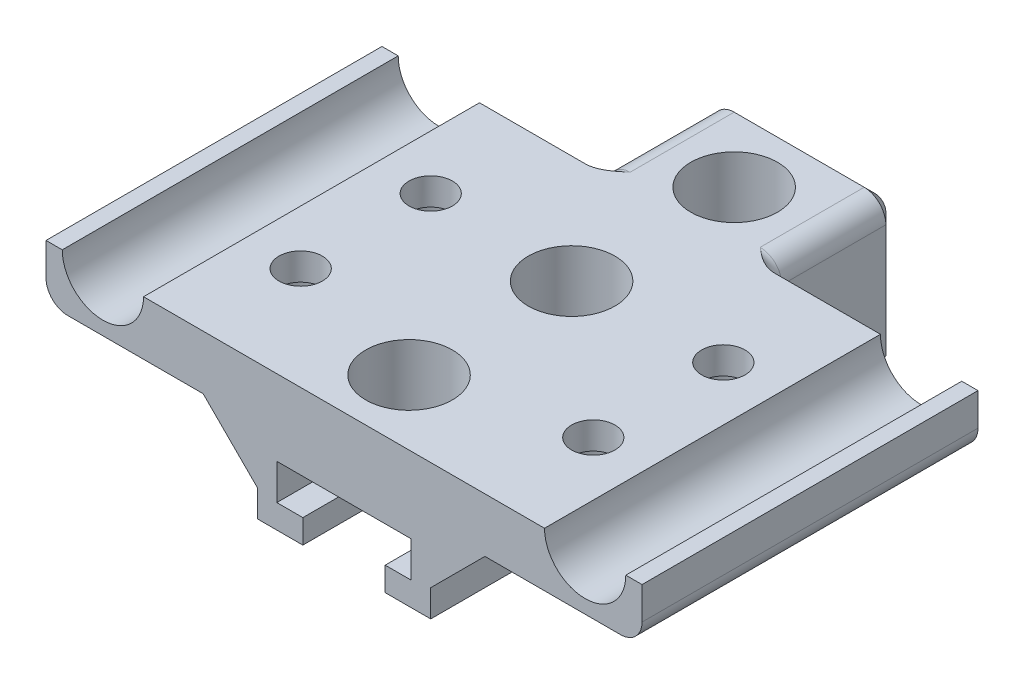
from build123d import *

# Parameters (mm, degrees)
SKETCH_1_W               = 16
SKETCH_1_H               = 8
EXTRUDE_1_DEPTH          = 43
CUT_EXTRUDE_1_DEPTH      = 44.920382512
EXTRUDE_2_DEPTH          = 31
FILLET_1_R               = 2
CHAMFER_1_SIZE           = 5
SKETCH_5_R               = 2
CUT_EXTRUDE_3_DEPTH      = 53.671149598
CUT_EXTRUDE_4_DEPTH      = 52.664784912
CUT_EXTRUDE_4_DEPTH_BACK = 2.5
SKETCH_6_R               = 3.75
SKETCH_8_W               = 16
SKETCH_8_H               = 5
EXTRUDE_4_DEPTH          = 12
SKETCH_3_R               = 4
CUT_EXTRUDE_2_DEPTH      = 6.2
SKETCH_10_W              = 4.2
SKETCH_10_H              = 0.5
CUT_EXTRUDE_5_DEPTH      = 52.829045911
FILLET_2_R               = 2
CHAMFER_2_SIZE           = 1
FILLET_3_R               = 1.4
CUT_EXTRUDE_6_DEPTH      = 1.2


with BuildPart() as part:
    # 草圖1 → 填料-伸長1 (new body)
    with BuildSketch(Plane.XY):
        Rectangle(SKETCH_1_W, SKETCH_1_H)
    extrude(amount=EXTRUDE_1_DEPTH)

    # 草圖2 → 除料-伸長1 (cut, through all)
    with BuildSketch(Plane.XY.offset(43)):
        Polygon((-6.2, 2), (6.2, 2), (6.2, -1.3), (3.8, -1.3), (3.8, -4), (-3.8, -4), (-3.8, -1.3), (-6.2, -1.3), align=None)
    extrude(amount=-CUT_EXTRUDE_1_DEPTH, mode=Mode.SUBTRACT)

    # 草圖4 → 填料-伸長2 (add)
    with BuildSketch(Plane.XY.offset(43)):
        with BuildLine():
            Line((-27.5, 4), (27.5, 4))
            Line((27.5, 4), (27.5, 9))
            Line((27.5, 9), (26, 9))
            ThreePointArc((26, 9), (22.25, 5.25), (18.5, 9))
            Line((18.5, 9), (-18.5, 9))
            ThreePointArc((-18.5, 9), (-22.25, 5.25), (-26, 9))
            Line((-26, 9), (-27.5, 9))
            Line((-27.5, 9), (-27.5, 4))
        make_face()
    extrude(amount=-EXTRUDE_2_DEPTH)

    # 圓角1
    fillet_1_edges = [part.edges().sort_by_distance(p)[0] for p in [
        (-27.5, 4, 27.5),
        (27.5, 4, 27.5),
    ]]
    fillet(fillet_1_edges, radius=FILLET_1_R)

    # 導角1
    chamfer_1_edges = [part.edges().sort_by_distance(p)[0] for p in [
        (-8, 4, 27.5),
        (8, 4, 27.5),
    ]]
    chamfer(chamfer_1_edges, length=CHAMFER_1_SIZE)

    # 草圖5 → 除料-伸長3 (cut, through all)
    with BuildSketch(Plane(origin=(0, 9, 0), x_dir=(1, 0, 0), z_dir=(0, 1, 0))):
        with Locations(Location((-13.5, -21.5, 0), (0, 0, 270))):
            Circle(SKETCH_5_R)
        with Locations(Location((13.5, -21.5, 0), (0, 0, 270))):
            Circle(SKETCH_5_R)
        with Locations(Location((13.5, -33.5, 0), (0, 0, 255.522487814))):
            Circle(SKETCH_5_R)
        with Locations(Location((-13.5, -33.5, 0), (0, 0, 284.477512186))):
            Circle(SKETCH_5_R)
    extrude(amount=-CUT_EXTRUDE_3_DEPTH, mode=Mode.SUBTRACT)

    # 草圖6 → 除料-伸長4 (cut, two sides: drawn at the far end of the back side and taken through both)
    with BuildSketch(Plane.XZ.offset(-4).offset(-CUT_EXTRUDE_4_DEPTH_BACK)):
        with Locations(Location((-13.5, 21.5, 0), (0, 0, 82.337744339))):
            Circle(SKETCH_6_R)
        with Locations(Location((13.5, 21.5, 0), (0, 0, 97.662255661))):
            Circle(SKETCH_6_R)
        with Locations(Location((13.5, 33.5, 0), (0, 0, 97.662255661))):
            Circle(SKETCH_6_R)
        with Locations(Location((-13.5, 33.5, 0), (0, 0, 82.337744339))):
            Circle(SKETCH_6_R)
    extrude(amount=CUT_EXTRUDE_4_DEPTH + CUT_EXTRUDE_4_DEPTH_BACK, mode=Mode.SUBTRACT)

    # 草圖8 → 填料-伸長4 (add)
    with BuildSketch(Plane(origin=(0, 0, 12), x_dir=(-1, 0, 0), z_dir=(0, 0, -1))):
        with Locations((0, 6.5)):
            Rectangle(SKETCH_8_W, SKETCH_8_H)
    extrude(amount=EXTRUDE_4_DEPTH)

    # 草圖3 → 除料-伸長2 (cut)
    with BuildSketch(Plane(origin=(0, 9, 0), x_dir=(1, 0, 0), z_dir=(0, 1, 0))):
        with Locations(Location((0, -37, 0), (0, 0, 270))):
            Circle(SKETCH_3_R)
        with Locations(Location((0, -22, 0), (0, 0, 270))):
            Circle(SKETCH_3_R)
        with Locations(Location((0, -7, 0), (0, 0, 270))):
            Circle(SKETCH_3_R)
    extrude(amount=-CUT_EXTRUDE_2_DEPTH, mode=Mode.SUBTRACT)

    # 草圖10 → 除料-伸長5 (cut, through all)
    with BuildSketch(Plane.XY.offset(43)):
        with Locations((-5.9, -3.75)):
            Rectangle(SKETCH_10_W, SKETCH_10_H)
        with Locations((5.9, -3.75)):
            Rectangle(SKETCH_10_W, SKETCH_10_H)
    extrude(amount=-CUT_EXTRUDE_5_DEPTH, mode=Mode.SUBTRACT)

    # 圓角2
    fillet_2_edges = [part.edges().sort_by_distance(p)[0] for p in [
        (-8, 9, 6),
        (8, 9, 6),
    ]]
    fillet(fillet_2_edges, radius=FILLET_2_R)

    # 導角2
    chamfer_2_edges = [part.edges().sort_by_distance(p)[0] for p in [
        (8, 1.75, 0),
        (0, 9, 0),
        (-8, 1.75, 0),
        (-7.414213562, 8.414213562, 0),
        (7.414213562, 8.414213562, 0),
    ]]
    chamfer(chamfer_2_edges, length=CHAMFER_2_SIZE)

    # 圓角3
    # the kernel refuses this fillet: 1.4 mm, written as the material it adds along each edge
    with BuildSketch(Plane(origin=(8, -4.5, 12), x_dir=(1, 0, 0), z_dir=(0, 1, 0))) as fillet_3_piece_1_section:
        with BuildLine():
            CenterArc((FILLET_3_R, FILLET_3_R), FILLET_3_R, 180, 90)
            Line((0, FILLET_3_R), (0, 0))
            Line((0, 0), (FILLET_3_R, 0))
        make_face()
    fillet_3_piece_1 = extrude(amount=11.5, mode=Mode.PRIVATE)
    fillet_3_piece_1 = split(fillet_3_piece_1, bisect_by=Plane(origin=(10.227813123, 1.227813123, 11.682011334), z_dir=(-0.7071067811865476, 0.7071067811865476, 0)), keep=Keep.TOP, mode=Mode.PRIVATE)
    add(fillet_3_piece_1)
    with BuildSketch(Plane(origin=(6, 7, 12), x_dir=(-0.9838603986795805, -0.17893774311211444, 0), z_dir=(0.17893774311211444, -0.9838603986795805, 0))) as fillet_3_piece_2_section:
        with BuildLine():
            CenterArc((2 + FILLET_3_R, FILLET_3_R), FILLET_3_R, 180, 90)
            Line((2 + FILLET_3_R, 0), (2, 0))
            Line((2, 0), (2, FILLET_3_R))
        make_face()
    fillet_3_piece_2 = revolve(axis=Axis((6, 7, 12), (0, 0, -1)), revolution_arc=190.307892466, mode=Mode.PRIVATE)
    fillet_3_piece_2 = split(fillet_3_piece_2, bisect_by=Plane(origin=(7.48329526, 9, 11.594565302), z_dir=(0, -1, 0)), keep=Keep.TOP, mode=Mode.PRIVATE)
    add(fillet_3_piece_2)
    with BuildSketch(Plane(origin=(-6, 7, 12), x_dir=(-1, 0, 0), z_dir=(0, -1, 0))) as fillet_3_piece_3_section:
        with BuildLine():
            CenterArc((2 + FILLET_3_R, FILLET_3_R), FILLET_3_R, 180, 90)
            Line((2 + FILLET_3_R, 0), (2, 0))
            Line((2, 0), (2, FILLET_3_R))
        make_face()
    fillet_3_piece_3 = revolve(axis=Axis((-6, 7, 12), (0, 0, -1)), revolution_arc=190.307892466, mode=Mode.PRIVATE)
    fillet_3_piece_3 = split(fillet_3_piece_3, bisect_by=Plane(origin=(-7.483295503, 9, 11.594566119), z_dir=(0, -1, 0)), keep=Keep.TOP, mode=Mode.PRIVATE)
    add(fillet_3_piece_3)
    with BuildSketch(Plane(origin=(-8, 7, 12), x_dir=(-1, 0, 0), z_dir=(0, -1, 0))) as fillet_3_piece_4_section:
        with BuildLine():
            CenterArc((FILLET_3_R, FILLET_3_R), FILLET_3_R, 180, 90)
            Line((0, FILLET_3_R), (0, 0))
            Line((0, 0), (FILLET_3_R, 0))
        make_face()
    fillet_3_piece_4 = extrude(amount=11.5, mode=Mode.PRIVATE)
    fillet_3_piece_4 = split(fillet_3_piece_4, bisect_by=Plane(origin=(-10.227813123, 1.227813123, 11.682011334), z_dir=(0.7071067811865476, 0.7071067811865476, 0)), keep=Keep.TOP, mode=Mode.PRIVATE)
    add(fillet_3_piece_4)

    # 草圖11 → 除料-伸長6 (cut)
    with BuildSketch(Plane(origin=(0, 0, 12), x_dir=(-1, 0, 0), z_dir=(0, 0, -1))):
        with BuildLine():
            add(Edge.make_bspline(
                [(-15.512965599, 5.255270581), (-15.414699377, 5.254159841), (-15.26654504, 5.269723993), (-15.070634174, 5.312629682), (-14.922188504, 5.360307872), (-14.772442736, 5.419941039), (-14.566974287, 5.518690642), (-14.419631195, 5.612638429), (-14.32170289, 5.67916026)],
                knots=[0, 0, 0, 0, 0.2291586, 0.346856629, 0.467982157, 0.59294755, 0.723185428, 1, 1, 1, 1], degree=3))
            add(Edge.make_bspline(
                [(-14.32170289, 5.67916026), (-14.361340614, 5.594402497), (-14.427448519, 5.473531235), (-14.525046047, 5.32243655), (-14.59983006, 5.21930979), (-14.679966937, 5.12588537), (-14.788204646, 5.012348241), (-14.878028191, 4.938643616), (-14.939972919, 4.894613063)],
                knots=[0, 0, 0, 0, 0.27789803, 0.408711059, 0.534275942, 0.656039227, 0.774144342, 1, 1, 1, 1], degree=3))
            add(Edge.make_bspline(
                [(-14.939972919, 4.894613063), (-14.989961256, 4.860663807), (-15.066962934, 4.814288531), (-15.174875072, 4.765966289), (-15.255511766, 4.735728118), (-15.337665232, 4.71338948), (-15.448713915, 4.691252394), (-15.533528007, 4.684203399), (-15.590249352, 4.684619833)],
                knots=[0, 0, 0, 0, 0.261398337, 0.387279958, 0.510791555, 0.633341278, 0.754911106, 1, 1, 1, 1], degree=3))
            add(Edge.make_bspline(
                [(-15.590249352, 4.684619833), (-15.666958981, 4.685092807), (-15.781638901, 4.69593118), (-15.928175213, 4.737366431), (-16.033718561, 4.779870577), (-16.135531308, 4.8345345), (-16.267361332, 4.92714585), (-16.357743573, 5.010420269), (-16.413048104, 5.07259989)],
                knots=[0, 0, 0, 0, 0.245474022, 0.365588279, 0.485788951, 0.608632713, 0.734185237, 1, 1, 1, 1], degree=3))
            add(Edge.make_bspline(
                [(-16.413048104, 5.07259989), (-16.486436291, 5.149790085), (-16.580821506, 5.281541796), (-16.680597485, 5.47550639), (-16.739967268, 5.635472042), (-16.788300278, 5.806560812), (-16.83307316, 6.058448797), (-16.845414663, 6.255134367), (-16.845524868, 6.389546279)],
                knots=[0, 0, 0, 0, 0.224560157, 0.340653479, 0.46005785, 0.584555283, 0.715942709, 1, 1, 1, 1], degree=3))
            add(Edge.make_bspline(
                [(-16.845524868, 6.389546279), (-16.845766789, 6.522968639), (-16.837283777, 6.718272995), (-16.803554657, 6.970044363), (-16.768245124, 7.143122359), (-16.724254813, 7.30589546), (-16.652769819, 7.505080593), (-16.581732618, 7.64380008), (-16.527802769, 7.729911988)],
                knots=[0, 0, 0, 0, 0.286836376, 0.419499479, 0.545655081, 0.666291914, 0.781656117, 1, 1, 1, 1], degree=3))
            add(Edge.make_bspline(
                [(-16.527802769, 7.729911988), (-16.475253534, 7.808774507), (-16.389068606, 7.920852663), (-16.247606636, 8.039056504), (-16.136046853, 8.111398184), (-16.015003992, 8.165978133), (-15.840022534, 8.220849525), (-15.70011978, 8.234017061), (-15.605862232, 8.234207997)],
                knots=[0, 0, 0, 0, 0.259167332, 0.381556643, 0.501241574, 0.620640046, 0.742518077, 1, 1, 1, 1], degree=3))
            add(Edge.make_bspline(
                [(-15.605862232, 8.234207997), (-15.544717191, 8.233967403), (-15.422688438, 8.220230604), (-15.307161955, 8.178413821), (-15.253011154, 8.150679092)],
                knots=[0, 0, 0, 0, 0.501438966, 1, 1, 1, 1], degree=3))
            add(Edge.make_bspline(
                [(-15.253011154, 8.150679092), (-15.232275736, 8.133755314), (-15.206788091, 8.107140401), (-15.173989427, 8.076950865), (-15.158151075, 8.059412734), (-15.147479909, 8.046273137), (-15.141652243, 8.039053711), (-15.140693744, 8.035516612)],
                knots=[0, 0, 0, 0, 0.465485033, 0.641943688, 0.776824332, 0.876730976, 0.937633266, 0.937633266, 0.937633266, 0.937633266], degree=3))
            add(Edge.make_bspline(
                [(-15.140693744, 8.035516612), (-15.133787772, 8.044366191), (-15.116403306, 8.070385906), (-15.077167958, 8.152583209), (-15.048667508, 8.22671454), (-15.028185689, 8.282607924)],
                knots=[0.030175483, 0.030175483, 0.030175483, 0.030175483, 0.149660543, 0.364790765, 1, 1, 1, 1], degree=3))
            add(Edge.make_bspline(
                [(-15.028185689, 8.282607924), (-15.009725876, 8.276858426), (-14.981099314, 8.261367171), (-14.943150161, 8.231982222), (-14.907607028, 8.201886929), (-14.868383119, 8.164770132), (-14.80765487, 8.102314078), (-14.760586835, 8.051494923), (-14.729199046, 8.014066396)],
                knots=[0, 0, 0, 0, 0.142547286, 0.238878223, 0.355067871, 0.487276599, 0.63850083, 1, 1, 1, 1], degree=3))
            add(Edge.make_bspline(
                [(-14.729199046, 8.014066396), (-14.679820714, 7.954832181), (-14.596630502, 7.84611307), (-14.554817703, 7.714879841), (-14.554334795, 7.656531454)],
                knots=[0, 0, 0, 0, 0.573162062, 1, 1, 1, 1], degree=3))
            add(Edge.make_bspline(
                [(-14.554334795, 7.656531454), (-14.55573328, 7.604762947), (-14.559344601, 7.529719841), (-14.59079845, 7.441578691), (-14.620378906, 7.389562676), (-14.660674885, 7.349448476), (-14.728595988, 7.309280902), (-14.78991609, 7.301591113), (-14.830682763, 7.301338445)],
                knots=[0, 0, 0, 0, 0.30492955, 0.43093638, 0.544107034, 0.651620768, 0.75931712, 1, 1, 1, 1], degree=3))
            add(Edge.make_bspline(
                [(-14.830682763, 7.301338445), (-14.841544953, 7.302291561), (-14.86032407, 7.310786374), (-14.889744485, 7.326072081), (-14.922917623, 7.344860193), (-14.963714625, 7.368183839), (-15.032329193, 7.410250355), (-15.087326472, 7.444594797), (-15.12654683, 7.4691769)],
                knots=[0, 0, 0, 0, 0.094521052, 0.179484873, 0.292195612, 0.429600385, 0.592893667, 1, 1, 1, 1], degree=3))
            add(Edge.make_bspline(
                [(-15.12654683, 7.4691769), (-15.199975384, 7.514202137), (-15.343776237, 7.586470467), (-15.502111383, 7.616327936), (-15.575417117, 7.616718611)],
                knots=[0, 0, 0, 0, 0.541453495, 1, 1, 1, 1], degree=3))
            add(Edge.make_bspline(
                [(-15.575417117, 7.616718611), (-15.615784116, 7.616596914), (-15.677009176, 7.607829628), (-15.752469197, 7.574778739), (-15.8067654, 7.540709431), (-15.858552546, 7.497438846), (-15.926261978, 7.423131816), (-15.96951886, 7.357849076), (-15.996184221, 7.310706172)],
                knots=[0, 0, 0, 0, 0.221792064, 0.333701628, 0.449768155, 0.572417113, 0.702735877, 1, 1, 1, 1], degree=3))
            add(Edge.make_bspline(
                [(-15.996184221, 7.310706172), (-16.027670327, 7.257543102), (-16.064164483, 7.168850026), (-16.10264178, 7.042622477), (-16.126743645, 6.935639477), (-16.145175717, 6.819587789), (-16.162879041, 6.647083036), (-16.168974735, 6.513023329), (-16.167925896, 6.420772038)],
                knots=[0, 0, 0, 0, 0.201775088, 0.313152638, 0.432066248, 0.560725755, 0.697893267, 1, 1, 1, 1], degree=3))
            add(Edge.make_bspline(
                [(-16.167925896, 6.420772038), (-16.166824182, 6.32573813), (-16.162572512, 6.187254805), (-16.137709457, 6.010213972), (-16.113107174, 5.89141668), (-16.081314281, 5.782406175), (-16.030568676, 5.653793585), (-15.980529466, 5.566139031), (-15.940758498, 5.514444381)],
                knots=[0, 0, 0, 0, 0.300345914, 0.43641313, 0.564039626, 0.683111862, 0.794491467, 1, 1, 1, 1], degree=3))
            add(Edge.make_bspline(
                [(-15.940758498, 5.514444381), (-15.910669985, 5.474312305), (-15.863169015, 5.418543093), (-15.791748561, 5.356567409), (-15.738783043, 5.319582648), (-15.684200812, 5.29100235), (-15.610149731, 5.263799104), (-15.55180694, 5.25480104), (-15.512965599, 5.255270581)],
                knots=[0, 0, 0, 0, 0.290049453, 0.421162096, 0.545441934, 0.662452142, 0.776130833, 1, 1, 1, 1], degree=3))
        make_face()
        with BuildLine():
            add(Edge.make_bspline(
                [(-12.044282778, 6.7745997), (-12.043995062, 6.799091234), (-12.043783764, 6.823584331)],
                knots=[0.941138595, 0.941138595, 0.941138595, 1, 1, 1], degree=2))
            add(Edge.make_bspline(
                [(-12.043783764, 6.823584331), (-12.042862242, 6.934444436), (-12.039522555, 7.09029638), (-12.037800584, 7.283907298), (-12.035878046, 7.397353644), (-12.035284005, 7.489474465), (-12.034568268, 7.570142602), (-12.033344474, 7.620096948), (-12.033635392, 7.646383083)],
                knots=[0, 0, 0, 0, 0.404182111, 0.568316414, 0.705889519, 0.817838935, 0.904174919, 1, 1, 1, 1], degree=3))
            add(Edge.make_bspline(
                [(-12.033635392, 7.646383083), (-12.034899202, 7.67602141), (-12.033504068, 7.717231246), (-12.037267638, 7.767958818), (-12.040017024, 7.796360332), (-12.043969284, 7.818911498), (-12.048621353, 7.837090967), (-12.05435247, 7.848269832), (-12.060957932, 7.849350517)],
                knots=[0, 0, 0, 0, 0.424717304, 0.588998461, 0.72762706, 0.833577365, 0.914932906, 1, 1, 1, 1], degree=3))
            add(Edge.make_bspline(
                [(-12.060957932, 7.849350517), (-12.05984125, 7.843986649), (-12.0754378, 7.840419153), (-12.09289379, 7.828422377), (-12.123679656, 7.814354662), (-12.162359505, 7.795573714), (-12.233224644, 7.761133243), (-12.291252391, 7.734200438), (-12.33340268, 7.715079753)],
                knots=[0, 0, 0, 0, 0.046726134, 0.118814664, 0.227505899, 0.369395017, 0.545604088, 1, 1, 1, 1], degree=3))
            add(Edge.make_bspline(
                [(-12.33340268, 7.715079753), (-12.303824675, 7.791756497), (-12.261595729, 7.900730259), (-12.189948661, 8.028059832), (-12.140892818, 8.102097962), (-12.090529052, 8.159842917), (-12.025774629, 8.213091691), (-11.969728398, 8.235350961), (-11.932151675, 8.234207997)],
                knots=[0, 0, 0, 0, 0.35894422, 0.507247956, 0.636247595, 0.745524815, 0.839950671, 1, 1, 1, 1], degree=3))
            add(Edge.make_bspline(
                [(-11.932151675, 8.234207997), (-11.901026373, 8.233467713), (-11.853341724, 8.22904328), (-11.793049576, 8.207283032), (-11.747774966, 8.186267084), (-11.702619207, 8.159619918), (-11.642907315, 8.112712021), (-11.601145982, 8.071546734), (-11.574616734, 8.041388935)],
                knots=[0, 0, 0, 0, 0.223861911, 0.338171268, 0.457371705, 0.581031901, 0.712581509, 1, 1, 1, 1], degree=3))
            add(Edge.make_bspline(
                [(-11.574616734, 8.041388935), (-11.543902053, 8.010016731), (-11.504496538, 7.96055959), (-11.456600155, 7.894922755), (-11.4300151, 7.847488138), (-11.409187098, 7.801698088), (-11.387587337, 7.744682639), (-11.382590112, 7.700460093), (-11.381797671, 7.672144334)],
                knots=[0, 0, 0, 0, 0.308571641, 0.445382466, 0.571801884, 0.690743521, 0.799749167, 1, 1, 1, 1], degree=3))
            add(Edge.make_bspline(
                [(-11.381797671, 7.672144334), (-11.381684503, 7.668484799), (-11.38276822, 7.659903255), (-11.384460567, 7.644594107), (-11.385546322, 7.623679097), (-11.389535701, 7.59703292), (-11.391540271, 7.548416195), (-11.397674703, 7.509367086), (-11.398971839, 7.480886559)],
                knots=[0, 0, 0, 0, 0.057089948, 0.134745619, 0.240739599, 0.383929581, 0.555081239, 1, 1, 1, 1], degree=3))
            add(Edge.make_bspline(
                [(-11.398971839, 7.480886559), (-11.41376156, 7.324650293), (-11.420049226, 7.167848325)],
                knots=[0, 0, 0, 1, 1, 1], degree=2))
            add(Edge.make_bspline(
                [(-11.420049226, 7.167848325), (-11.42935424, 6.909796791), (-11.439483364, 6.377916998), (-11.444590196, 5.845974218), (-11.44424919, 5.572212035)],
                knots=[0, 0, 0, 0, 0.485384535, 1, 1, 1, 1], degree=3))
            add(Edge.make_bspline(
                [(-11.44424919, 5.572212035), (-11.445242149, 5.458578271), (-11.454689637, 5.249352056), (-11.507303846, 5.046442061), (-11.542610331, 4.958625869)],
                knots=[0, 0, 0, 0, 0.546327903, 1, 1, 1, 1], degree=3))
            add(Edge.make_bspline(
                [(-11.542610331, 4.958625869), (-11.557596685, 4.911069002), (-11.579683855, 4.843188441), (-11.623224357, 4.764561061), (-11.656537903, 4.718626307), (-11.693535301, 4.682455404), (-11.747071133, 4.648939215), (-11.792319258, 4.636441738), (-11.822861519, 4.637781195)],
                knots=[0, 0, 0, 0, 0.328144135, 0.464957548, 0.588231467, 0.699328578, 0.802125792, 1, 1, 1, 1], degree=3))
            add(Edge.make_bspline(
                [(-11.822861519, 4.637781195), (-11.847029004, 4.637443438), (-11.88433909, 4.647659512), (-11.930192852, 4.67544365), (-11.966926809, 4.704778343), (-12.004625299, 4.741669621), (-12.041895775, 4.787639311), (-12.080166667, 4.841656541), (-12.118515395, 4.904107402), (-12.15917636, 4.973838681), (-12.197948905, 5.053037778), (-12.239997855, 5.139415411), (-12.280726078, 5.234849659), (-12.323159876, 5.338058907), (-12.381852844, 5.491714723), (-12.424956695, 5.611570297), (-12.452060564, 5.69477314)],
                knots=[0, 0, 0, 0, 0.056453286, 0.089167736, 0.125855281, 0.167058501, 0.213234192, 0.265139963, 0.323001969, 0.385916018, 0.455312491, 0.530755317, 0.612338233, 0.69981122, 0.793781828, 1, 1, 1, 1], degree=3))
            add(Edge.make_bspline(
                [(-12.452060564, 5.69477314), (-12.414457953, 5.681531143), (-12.359682514, 5.66595505), (-12.291336404, 5.64407296), (-12.247524651, 5.63365219), (-12.210010371, 5.62383544), (-12.170720789, 5.616330959), (-12.144106134, 5.612498746), (-12.128093314, 5.612024878)],
                knots=[0, 0, 0, 0, 0.356585115, 0.509864577, 0.642065772, 0.75957823, 0.856883807, 1, 1, 1, 1], degree=3))
            add(Edge.make_bspline(
                [(-12.128093314, 5.612024878), (-12.117288114, 5.611827175), (-12.09336706, 5.622929662), (-12.082666245, 5.647034231), (-12.077351455, 5.659644161)],
                knots=[0, 0, 0, 0, 0.428655626, 1, 1, 1, 1], degree=3))
            add(Edge.make_bspline(
                [(-12.077351455, 5.659644161), (-12.067435561, 5.700100127), (-12.053909703, 5.810680507), (-12.055279923, 5.921971959), (-12.053932136, 5.991417851)],
                knots=[0, 0, 0, 0, 0.374325657, 1, 1, 1, 1], degree=3))
            add(Edge.make_bspline(
                [(-12.053932136, 5.991417851), (-12.054238316, 6.019005049), (-12.053004838, 6.071041225), (-12.052288205, 6.154311457), (-12.051694918, 6.247993556), (-12.049774622, 6.362220524), (-12.048960282, 6.452937159), (-12.048270723, 6.50565666), (-12.048165992, 6.513360279)],
                knots=[0, 0, 0, 0, 0.099436359, 0.18761446, 0.300179787, 0.437142363, 0.599429252, 0.627201587, 0.627201587, 0.627201587, 0.627201587], degree=3))
            add(Edge.make_bspline(
                [(-12.048165992, 6.513360279), (-12.048526695, 6.513202708), (-12.064626961, 6.506177692), (-12.120191756, 6.483062416), (-12.177837902, 6.466449008), (-12.218648015, 6.454339729)],
                knots=[0.450888695, 0.450888695, 0.450888695, 0.450888695, 0.454476239, 0.610994776, 1, 1, 1, 1], degree=3))
            add(Edge.make_bspline(
                [(-12.218648015, 6.454339729), (-12.299882111, 6.433676973), (-12.414110762, 6.407165144), (-12.554956008, 6.372514996), (-12.636446229, 6.354556404), (-12.700616321, 6.3381403), (-12.75381902, 6.32715726), (-12.785278017, 6.320701726), (-12.801008422, 6.318507677)],
                knots=[0, 0, 0, 0, 0.420417791, 0.588208002, 0.727522358, 0.838959474, 0.920368149, 1, 1, 1, 1], degree=3))
            add(Edge.make_bspline(
                [(-12.801008422, 6.318507677), (-12.826340217, 6.318045067), (-12.864957219, 6.325630581), (-12.913395046, 6.348603443), (-12.950005092, 6.373294181), (-12.987029742, 6.404003622), (-13.038085923, 6.456798783), (-13.072550227, 6.502964307), (-13.094530557, 6.536307347)],
                knots=[0, 0, 0, 0, 0.199082476, 0.305665486, 0.421303183, 0.546739767, 0.684715424, 1, 1, 1, 1], degree=3))
            add(Edge.make_bspline(
                [(-13.094530557, 6.536307347), (-13.098879231, 6.458922542), (-13.10948971, 6.331989271), (-13.121395744, 6.186349983), (-13.127485958, 6.117995896), (-13.129203147, 6.099323718)],
                knots=[0, 0, 0, 0, 0.419764578, 0.689913437, 0.7914802, 0.7914802, 0.7914802, 0.7914802], degree=3))
            add(Edge.make_bspline(
                [(-13.129203147, 6.099323718), (-13.124058547, 6.106156513), (-13.105158008, 6.129896973), (-13.046081155, 6.194345835), (-12.98706381, 6.246899923), (-12.94386627, 6.284159342)],
                knots=[0.343318873, 0.343318873, 0.343318873, 0.343318873, 0.407545732, 0.570919874, 1, 1, 1, 1], degree=3))
            add(Edge.make_bspline(
                [(-12.94386627, 6.284159342), (-12.977519555, 6.15495862), (-13.021547433, 5.967245998), (-13.07345559, 5.725160532), (-13.10274388, 5.563920535), (-13.12676722, 5.416447923), (-13.147524018, 5.246916673), (-13.156490706, 5.126170548), (-13.156201432, 5.049961215)],
                knots=[0, 0, 0, 0, 0.319113626, 0.460874783, 0.591787605, 0.710823991, 0.817991027, 1, 1, 1, 1], degree=3))
            add(Edge.make_bspline(
                [(-13.156201432, 5.049961215), (-13.157488041, 4.996693218), (-13.158780111, 4.920928651), (-13.181392273, 4.829852274), (-13.20187582, 4.777557681), (-13.228655627, 4.735631721), (-13.274707127, 4.695510593), (-13.319543378, 4.683668348), (-13.349020494, 4.684619833)],
                knots=[0, 0, 0, 0, 0.348333469, 0.487970207, 0.608721201, 0.712513668, 0.808572711, 1, 1, 1, 1], degree=3))
            add(Edge.make_bspline(
                [(-13.349020494, 4.684619833), (-13.376145671, 4.683942276), (-13.416870956, 4.698782957), (-13.464122626, 4.735855304), (-13.49988984, 4.77599388), (-13.536114379, 4.826134211), (-13.583865246, 4.91529699), (-13.616416134, 4.988923242), (-13.63473619, 5.042935419)],
                knots=[0, 0, 0, 0, 0.1656801, 0.261563409, 0.371598676, 0.499246886, 0.64569912, 1, 1, 1, 1], degree=3))
            add(Edge.make_bspline(
                [(-13.63473619, 5.042935419), (-13.670037952, 5.146636592), (-13.723106629, 5.348532222), (-13.745853726, 5.556157638), (-13.745587634, 5.654960297)],
                knots=[0, 0, 0, 0, 0.526101089, 1, 1, 1, 1], degree=3))
            add(Edge.make_bspline(
                [(-13.745587634, 5.654960297), (-13.745804476, 5.682609924), (-13.741679811, 5.731718516), (-13.737776095, 5.808017021), (-13.73131306, 5.888682665), (-13.722229344, 5.984871809), (-13.709650978, 6.144536548), (-13.696555261, 6.271897155), (-13.688600624, 6.36222374)],
                knots=[0, 0, 0, 0, 0.116756023, 0.208224429, 0.32296602, 0.458810295, 0.616668162, 1, 1, 1, 1], degree=3))
            add(Edge.make_bspline(
                [(-13.688600624, 6.36222374), (-13.682017047, 6.453374563), (-13.669018713, 6.583801072), (-13.657921201, 6.749964298), (-13.649485433, 6.855792797), (-13.644212371, 6.949246721), (-13.639258169, 7.049146014), (-13.637193957, 7.11812873), (-13.637078122, 7.160041885)],
                knots=[0, 0, 0, 0, 0.342851936, 0.491627138, 0.624753007, 0.741125337, 0.84277065, 1, 1, 1, 1], degree=3))
            Line((-13.637078122, 7.160041885), (-13.637078122, 8.254504741))
            add(Edge.make_bspline(
                [(-13.637078122, 8.254504741), (-13.575837807, 8.215352278), (-13.489385821, 8.160162948), (-13.382080777, 8.089899682), (-13.318404358, 8.04710996), (-13.265623576, 8.011232371), (-13.21762326, 7.976492053), (-13.186711692, 7.954145708), (-13.171033667, 7.939905218)],
                knots=[0, 0, 0, 0, 0.387621165, 0.546961994, 0.683976656, 0.796754403, 0.88725151, 1, 1, 1, 1], degree=3))
            add(Edge.make_bspline(
                [(-13.171033667, 7.939905218), (-13.141688266, 7.909467789), (-13.10333199, 7.861870871), (-13.06438205, 7.794255165), (-13.045104529, 7.746187051), (-13.034923974, 7.69893055), (-13.031201367, 7.63701784), (-13.042210806, 7.591581984), (-13.054717715, 7.563634821)],
                knots=[0, 0, 0, 0, 0.302894778, 0.435634495, 0.557848905, 0.672308659, 0.780588575, 1, 1, 1, 1], degree=3))
            add(Edge.make_bspline(
                [(-13.054717715, 7.563634821), (-13.062543827, 7.560098455), (-13.071153964, 7.547612312), (-13.079065675, 7.526355175), (-13.084391922, 7.502439288), (-13.087884487, 7.472625139), (-13.090949523, 7.436693198), (-13.093384332, 7.395047771), (-13.09384457, 7.347396494), (-13.093830695, 7.294052055), (-13.09324831, 7.234442626), (-13.090525721, 7.169142676), (-13.087724364, 7.09781205), (-13.08262426, 7.020562222), (-13.075572498, 6.905455521), (-13.067245468, 6.816311724), (-13.062524154, 6.754887661)],
                knots=[0, 0, 0, 0, 0.030150403, 0.053693819, 0.083059336, 0.11959487, 0.163609611, 0.215164218, 0.272366863, 0.338140771, 0.410593664, 0.490717297, 0.577546357, 0.672090773, 0.774306025, 1, 1, 1, 1], degree=3))
            add(Edge.make_bspline(
                [(-13.062524154, 6.754887661), (-13.04561667, 6.759864576), (-13.017873809, 6.770069756), (-12.977130859, 6.78521633), (-12.937746359, 6.800078619), (-12.892852355, 6.818091017), (-12.821491643, 6.846559096), (-12.765338971, 6.869333375), (-12.7260666, 6.885255205)],
                knots=[0, 0, 0, 0, 0.146408153, 0.245649162, 0.361346683, 0.496307384, 0.647735833, 1, 1, 1, 1], degree=3))
            add(Edge.make_bspline(
                [(-12.7260666, 6.885255205), (-12.688087177, 6.899337075), (-12.634914821, 6.919325977), (-12.56872178, 6.943003845), (-12.530286344, 6.956017088), (-12.499784469, 6.967253315), (-12.473601839, 6.976214944), (-12.457279907, 6.980553499), (-12.448937988, 6.982835702)],
                knots=[0, 0, 0, 0, 0.413501818, 0.579856821, 0.717627949, 0.827697507, 0.911698046, 1, 1, 1, 1], degree=3))
            add(Edge.make_bspline(
                [(-12.448937988, 6.982835702), (-12.383858845, 6.982498557), (-12.247559311, 6.955654067), (-12.137814971, 6.870615216), (-12.088280471, 6.822023043)],
                knots=[0, 0, 0, 0, 0.482707121, 1, 1, 1, 1], degree=3))
            add(Edge.make_bspline(
                [(-12.088280471, 6.822023043), (-12.065924974, 6.798579884), (-12.044282778, 6.7745997)],
                knots=[0, 0, 0, 0.244224917, 0.244224917, 0.244224917], degree=2))
        make_face()
        with BuildLine():
            add(Edge.make_bspline(
                [(16.604305879, 8.106963029), (16.64391719, 8.082200045), (16.70129581, 8.046783296), (16.764777882, 7.990141072), (16.803351013, 7.951423012), (16.832357062, 7.911154885), (16.860391569, 7.859691472), (16.870299393, 7.817983061), (16.869724831, 7.790802218)],
                knots=[0, 0, 0, 0, 0.326782432, 0.466930186, 0.592701736, 0.707035939, 0.811749525, 1, 1, 1, 1], degree=3))
            add(Edge.make_bspline(
                [(16.869724831, 7.790802218), (16.868331089, 7.771035128), (16.855830184, 7.708339878), (16.840950062, 7.646323269), (16.830692632, 7.603447664)],
                knots=[0, 0, 0, 0, 0.309802912, 1, 1, 1, 1], degree=3))
            add(Edge.make_bspline(
                [(16.830692632, 7.603447664), (16.821750562, 7.565566708), (16.809066831, 7.495640543), (16.802251703, 7.424841769), (16.802589449, 7.39267379)],
                knots=[0, 0, 0, 0, 0.547805294, 1, 1, 1, 1], degree=3))
            add(Edge.make_bspline(
                [(16.802589449, 7.39267379), (16.802793647, 7.354941573), (16.802391223, 7.292738962), (16.799847967, 7.202467068), (16.799672631, 7.117881047), (16.797915266, 7.022122444), (16.794406102, 6.872252518), (16.79237964, 6.754367976), (16.790879789, 6.672139399)],
                knots=[0, 0, 0, 0, 0.157079655, 0.258929261, 0.375926494, 0.509185244, 0.657627616, 1, 1, 1, 1], degree=3))
            add(Edge.make_bspline(
                [(16.790879789, 6.672139399), (16.789591144, 6.587564256), (16.786791738, 6.464496481), (16.784407992, 6.305241661), (16.784214306, 6.196980312), (16.78212476, 6.09628991), (16.781164886, 5.976847303), (16.78166518, 5.890974825), (16.781512062, 5.8360697)],
                knots=[0, 0, 0, 0, 0.303480327, 0.441669652, 0.571447081, 0.691899362, 0.803004827, 1, 1, 1, 1], degree=3))
            add(Edge.make_bspline(
                [(16.781512062, 5.8360697), (16.782697317, 5.745986975), (16.778883089, 5.61561404), (16.772343076, 5.447708574), (16.763261579, 5.335325401), (16.753493254, 5.231673949), (16.741489649, 5.137014385), (16.725447214, 5.051750079), (16.708728957, 4.974998307), (16.689464057, 4.907105312), (16.667909431, 4.848175647), (16.6436591, 4.798416651), (16.617517115, 4.757205332), (16.588201519, 4.72519363), (16.546946136, 4.694175349), (16.509739164, 4.684793746), (16.485647994, 4.684619833)],
                knots=[0, 0, 0, 0, 0.214682505, 0.310931734, 0.40051957, 0.483416709, 0.559130072, 0.627874895, 0.690180292, 0.746333052, 0.795994373, 0.839550232, 0.878090682, 0.91189158, 0.942539924, 1, 1, 1, 1], degree=3))
            add(Edge.make_bspline(
                [(16.485647994, 4.684619833), (16.471807697, 4.68527136), (16.449658298, 4.693624977), (16.419604432, 4.711787337), (16.391745635, 4.733461625), (16.359557647, 4.759801459), (16.30969598, 4.806891589), (16.272641145, 4.847114441), (16.245990293, 4.875096964)],
                knots=[0, 0, 0, 0, 0.131890119, 0.225382859, 0.338431544, 0.472239725, 0.626877398, 1, 1, 1, 1], degree=3))
            add(Edge.make_bspline(
                [(16.245990293, 4.875096964), (16.205713944, 4.917863942), (16.135383558, 4.992828294), (16.071459064, 5.073350725), (16.046145435, 5.109290157)],
                knots=[0, 0, 0, 0, 0.572146094, 1, 1, 1, 1], degree=3))
            add(Edge.make_bspline(
                [(16.046145435, 5.109290157), (16.000788062, 5.173591735), (15.914672475, 5.313291316), (15.845719736, 5.462204422), (15.81351353, 5.540986276)],
                knots=[0, 0, 0, 0, 0.480310601, 1, 1, 1, 1], degree=3))
            add(Edge.make_bspline(
                [(15.81351353, 5.540986276), (15.773528773, 5.632055194), (15.713529162, 5.780574676), (15.635800884, 5.995124448), (15.568725887, 6.187633845), (15.49770079, 6.401819721), (15.393747822, 6.730290292), (15.315265873, 6.988003626), (15.261598238, 7.167067681)],
                knots=[0, 0, 0, 0, 0.173657297, 0.279593826, 0.398429257, 0.529610899, 0.673594201, 1, 1, 1, 1], degree=3))
            add(Edge.make_bspline(
                [(15.261598238, 7.167067681), (15.263169603, 7.135862873), (15.263864134, 7.085369616), (15.264522357, 7.013532579), (15.266651139, 6.949018941), (15.266994404, 6.877707495), (15.267909546, 6.799125068), (15.268656495, 6.713773859), (15.269369645, 6.621397587), (15.270491064, 6.52225792), (15.269834099, 6.416086047), (15.271359038, 6.302897033), (15.270603348, 6.182673676), (15.272077433, 6.055432481), (15.271503064, 5.871978567), (15.271878069, 5.730943385), (15.27174661, 5.634663553)],
                knots=[0, 0, 0, 0, 0.06114984, 0.09884868, 0.140631679, 0.187498997, 0.238441272, 0.294477288, 0.354588325, 0.419283785, 0.488561814, 0.562426176, 0.640873357, 0.723906676, 0.811523007, 1, 1, 1, 1], degree=3))
            add(Edge.make_bspline(
                [(15.27174661, 5.634663553), (15.271896427, 5.560495002), (15.270551476, 5.452661847), (15.262843641, 5.314275269), (15.256024883, 5.221313115), (15.246904566, 5.135872349), (15.235082341, 5.057803191), (15.222055087, 4.98712584), (15.206811286, 4.923905424), (15.188573154, 4.86827108), (15.169738604, 4.819499473), (15.14753298, 4.778666221), (15.124580819, 4.744313619), (15.098269679, 4.717941712), (15.060948584, 4.69220195), (15.02776832, 4.685004864), (15.006327657, 4.684619833)],
                knots=[0, 0, 0, 0, 0.211935444, 0.307984568, 0.395969195, 0.47823643, 0.553415492, 0.621511293, 0.68354119, 0.739028394, 0.788729999, 0.832638992, 0.87161996, 0.906317139, 0.938484703, 1, 1, 1, 1], degree=3))
            add(Edge.make_bspline(
                [(15.006327657, 4.684619833), (14.986755793, 4.684382099), (14.956702792, 4.695750293), (14.919699528, 4.72281377), (14.888793175, 4.752962246), (14.855801224, 4.790736858), (14.807379845, 4.856952032), (14.772123116, 4.912046294), (14.749495789, 4.952380717)],
                knots=[0, 0, 0, 0, 0.150367085, 0.245395872, 0.357868709, 0.487890397, 0.637929598, 1, 1, 1, 1], degree=3))
            add(Edge.make_bspline(
                [(14.749495789, 4.952380717), (14.709288383, 5.026278295), (14.645816797, 5.157293526), (14.609764293, 5.299149146), (14.609760517, 5.360657517)],
                knots=[0, 0, 0, 0, 0.579954031, 1, 1, 1, 1], degree=3))
            add(Edge.make_bspline(
                [(14.609760517, 5.360657517), (14.610552726, 5.371846156), (14.612249814, 5.394734193), (14.61435283, 5.433589744), (14.619972779, 5.480803091), (14.62380909, 5.54050995), (14.633650002, 5.644251784), (14.639594449, 5.728415614), (14.64567014, 5.788450417)],
                knots=[0, 0, 0, 0, 0.078379367, 0.160386963, 0.271841874, 0.410466827, 0.578386742, 1, 1, 1, 1], degree=3))
            add(Edge.make_bspline(
                [(14.64567014, 5.788450417), (14.659151548, 5.925533827), (14.675454276, 6.205209225), (14.682698738, 6.485242828), (14.682360407, 6.627642692)],
                knots=[0, 0, 0, 0, 0.491659301, 1, 1, 1, 1], degree=3))
            add(Edge.make_bspline(
                [(14.682360407, 6.627642692), (14.682360407, 6.711171598), (14.682360407, 6.827487551), (14.682360407, 6.970865828), (14.682360407, 7.051532372), (14.682360407, 7.114244105), (14.682360407, 7.161863387), (14.682360407, 7.188665497), (14.682360407, 7.200635372)],
                knots=[0, 0, 0, 0, 0.4373297, 0.608991826, 0.750681199, 0.859673025, 0.9373297, 1, 1, 1, 1], degree=3))
            add(Edge.make_bspline(
                [(14.682360407, 7.200635372), (14.678650168, 7.305913676), (14.666809431, 7.509136783), (14.638861968, 7.710816948), (14.620689533, 7.807195742)],
                knots=[0, 0, 0, 0, 0.517942526, 1, 1, 1, 1], degree=3))
            add(Edge.make_bspline(
                [(14.620689533, 7.807195742), (14.609865774, 7.863313159), (14.548844636, 7.984282677), (14.457460582, 8.083210523), (14.402889863, 8.137408144)],
                knots=[0, 0, 0, 0, 0.423240823, 1, 1, 1, 1], degree=3))
            add(Edge.make_bspline(
                [(14.402889863, 8.137408144), (14.550284243, 8.169813351), (14.701095862, 8.171756479)],
                knots=[0, 0, 0, 1, 1, 1], degree=2))
            add(Edge.make_bspline(
                [(14.701095862, 8.171756479), (14.795826593, 8.171487478), (14.934938704, 8.159330859), (15.106441984, 8.104353429), (15.218781936, 8.048871688), (15.317910217, 7.976418508), (15.43633579, 7.856728613), (15.502434333, 7.745702472), (15.536384918, 7.665899182)],
                knots=[0, 0, 0, 0, 0.273498253, 0.397956496, 0.516967745, 0.632871664, 0.750017374, 1, 1, 1, 1], degree=3))
            Line((15.536384918, 7.665899182), (16.181196843, 5.901643794))
            add(Edge.make_bspline(
                [(16.181196843, 5.901643794), (16.183409616, 6.011463236), (16.188063451, 6.172513515), (16.19202158, 6.382522715), (16.195129884, 6.529544249), (16.19850726, 6.669529343), (16.200616007, 6.802508792), (16.202944842, 6.92845282), (16.205539837, 7.04736213), (16.206897867, 7.159522491), (16.208359545, 7.264390078), (16.210391522, 7.362481934), (16.210359093, 7.453313333), (16.212988698, 7.537343025), (16.212039713, 7.614120524), (16.213082357, 7.671295786), (16.21337771, 7.702714184), (16.213414115, 7.710973621)],
                knots=[0, 0, 0, 0, 0.178304435, 0.261535123, 0.340964998, 0.417016441, 0.488836257, 0.556855063, 0.621495257, 0.681904899, 0.738935661, 0.791742886, 0.841165928, 0.886371022, 0.928188992, 0.965785297, 0.979193127, 0.979193127, 0.979193127, 0.979193127], degree=3))
            add(Edge.make_bspline(
                [(16.213414115, 7.710973621), (16.198888142, 7.725769855), (16.169137375, 7.7581047), (16.127050313, 7.806650584), (16.086448461, 7.852158338), (16.054636727, 7.893719762), (16.029119532, 7.929629478), (16.007498064, 7.96622785), (15.997437228, 7.992592911), (15.996184221, 8.008601888)],
                knots=[0.041805789, 0.041805789, 0.041805789, 0.041805789, 0.201740648, 0.381039285, 0.537667875, 0.672244923, 0.784786411, 0.877455663, 1, 1, 1, 1], degree=3))
            add(Edge.make_bspline(
                [(15.996184221, 8.008601888), (15.996472392, 8.036388223), (16.020529569, 8.097837354), (16.067555409, 8.143297777), (16.094545362, 8.167853259)],
                knots=[0, 0, 0, 0, 0.426405654, 1, 1, 1, 1], degree=3))
            add(Edge.make_bspline(
                [(16.094545362, 8.167853259), (16.123367105, 8.18764038), (16.178226798, 8.219090004), (16.239818471, 8.234757698), (16.267848325, 8.234207997)],
                knots=[0, 0, 0, 0, 0.557784464, 1, 1, 1, 1], degree=3))
            add(Edge.make_bspline(
                [(16.267848325, 8.234207997), (16.320687689, 8.234338263), (16.439345564, 8.203062431), (16.546206969, 8.144071838), (16.604305879, 8.106963029)],
                knots=[0, 0, 0, 0, 0.431330589, 1, 1, 1, 1], degree=3))
        make_face()
        with BuildLine():
            add(Edge.make_bspline(
                [(13.631613614, 5.329431758), (13.674285683, 5.276487143), (13.748234133, 5.175245633), (13.779432614, 5.053494827), (13.779935969, 4.998438712)],
                knots=[0, 0, 0, 0, 0.555451073, 1, 1, 1, 1], degree=3))
            add(Edge.make_bspline(
                [(13.779935969, 4.998438712), (13.779514798, 4.974380095), (13.775797207, 4.937878967), (13.752240428, 4.898054594), (13.729458532, 4.87418165), (13.699685878, 4.856424427), (13.649076975, 4.837479465), (13.605934219, 4.834481458), (13.576187891, 4.834503477)],
                knots=[0, 0, 0, 0, 0.245261425, 0.354229287, 0.459625549, 0.573531556, 0.699302465, 1, 1, 1, 1], degree=3))
            add(Edge.make_bspline(
                [(13.576187891, 4.834503477), (13.550424363, 4.835684629), (13.46964742, 4.849712097), (13.389345706, 4.865235042), (13.334188258, 4.875877608)],
                knots=[0, 0, 0, 0, 0.314362885, 1, 1, 1, 1], degree=3))
            add(Edge.make_bspline(
                [(13.334188258, 4.875877608), (13.258918657, 4.888185563), (13.093571686, 4.908832992), (12.926944684, 4.91083581), (12.836918045, 4.911787231)],
                knots=[0, 0, 0, 0, 0.458516671, 1, 1, 1, 1], degree=3))
            add(Edge.make_bspline(
                [(12.836918045, 4.911787231), (12.753889291, 4.911842585), (12.633135783, 4.909392816), (12.477650751, 4.8961035), (12.372575397, 4.884262457), (12.275245136, 4.867495488), (12.159646171, 4.843044991), (12.078014012, 4.8172229), (12.027390241, 4.796251922)],
                knots=[0, 0, 0, 0, 0.302958918, 0.440118667, 0.569158612, 0.68853639, 0.800244916, 1, 1, 1, 1], degree=3))
            add(Edge.make_bspline(
                [(12.027390241, 4.796251922), (12.014074738, 4.790438571), (11.972640815, 4.762367907), (11.929691763, 4.737078487), (11.900145272, 4.71740688)],
                knots=[0, 0, 0, 0, 0.289955947, 1, 1, 1, 1], degree=3))
            add(Edge.make_bspline(
                [(11.900145272, 4.71740688), (11.864077306, 4.699236682), (11.808262169, 4.674218225), (11.75093826, 4.651719288), (11.729964885, 4.64871021)],
                knots=[0, 0, 0, 0, 0.657092282, 1, 1, 1, 1], degree=3))
            add(Edge.make_bspline(
                [(11.729964885, 4.64871021), (11.715389925, 4.648201165), (11.694256463, 4.65902065), (11.667716551, 4.680830675), (11.64571445, 4.706015846), (11.622148595, 4.737692452), (11.586648439, 4.792677789), (11.561310326, 4.83858998), (11.544952263, 4.871974388)],
                knots=[0, 0, 0, 0, 0.140547739, 0.231430665, 0.344122206, 0.474595583, 0.627310756, 1, 1, 1, 1], degree=3))
            add(Edge.make_bspline(
                [(11.544952263, 4.871974388), (11.530248378, 4.901539252), (11.511674469, 4.944364101), (11.495384794, 5.000550298), (11.489672479, 5.035675481), (11.489101661, 5.066657794), (11.496343665, 5.100987766), (11.508751583, 5.123318191), (11.522313587, 5.132709476)],
                knots=[0, 0, 0, 0, 0.35413972, 0.499010054, 0.626074456, 0.734888293, 0.829010185, 1, 1, 1, 1], degree=3))
            add(Edge.make_bspline(
                [(11.522313587, 5.132709476), (11.535669318, 5.134044754), (11.551681935, 5.151133688), (11.558597628, 5.183873757), (11.560800085, 5.21912497), (11.556469166, 5.263476486), (11.547009067, 5.341665359), (11.530165705, 5.403901923), (11.520752299, 5.448870287)],
                knots=[0, 0, 0, 0, 0.111323208, 0.190906341, 0.295837283, 0.42646075, 0.588358381, 1, 1, 1, 1], degree=3))
            add(Edge.make_bspline(
                [(11.520752299, 5.448870287), (11.535727566, 5.508351894), (11.553203428, 5.601214878), (11.571452835, 5.729446606), (11.583173371, 5.833298134), (11.591559078, 5.942671291), (11.600035675, 6.099035406), (11.602451079, 6.219344657), (11.602719917, 6.30133351)],
                knots=[0, 0, 0, 0, 0.214283084, 0.33004863, 0.452688224, 0.57950955, 0.713409784, 1, 1, 1, 1], degree=3))
            add(Edge.make_bspline(
                [(11.602719917, 6.30133351), (11.602832914, 6.496033075), (11.587107037, 6.690094211)],
                knots=[0, 0, 0, 1, 1, 1], degree=2))
            add(Edge.make_bspline(
                [(11.587107037, 6.690094211), (11.582041101, 6.74258039), (11.577274756, 6.82353121), (11.571445985, 6.904455063), (11.571494158, 6.932874487)],
                knots=[0, 0, 0, 0, 0.649871696, 1, 1, 1, 1], degree=3))
            add(Edge.make_bspline(
                [(11.571494158, 6.932874487), (11.570869162, 7.005775826), (11.581628548, 7.112372099), (11.619399824, 7.246308513), (11.660122195, 7.335538651), (11.710705573, 7.417612898), (11.796445732, 7.516647599), (11.876351718, 7.575955595), (11.933712963, 7.609692816)],
                knots=[0, 0, 0, 0, 0.270678995, 0.395516827, 0.515380974, 0.633955316, 0.752561186, 1, 1, 1, 1], degree=3))
            add(Edge.make_bspline(
                [(11.933712963, 7.609692816), (11.895749787, 7.637304197), (11.841248409, 7.681278297), (11.784286065, 7.752337468), (11.74745973, 7.806391229), (11.718473879, 7.864715191), (11.689186628, 7.947926118), (11.677841629, 8.013914415), (11.675319807, 8.058563103)],
                knots=[0, 0, 0, 0, 0.263306735, 0.387339164, 0.50795597, 0.628291823, 0.750199619, 1, 1, 1, 1], degree=3))
            add(Edge.make_bspline(
                [(11.675319807, 8.058563103), (11.734943785, 8.044861287), (11.861819468, 8.028245683), (11.98952926, 8.021538657), (12.056274068, 8.021872836)],
                knots=[0, 0, 0, 0, 0.478006643, 1, 1, 1, 1], degree=3))
            add(Edge.make_bspline(
                [(12.056274068, 8.021872836), (12.151195157, 8.021991935), (12.367683516, 8.043073614), (12.581600628, 8.081693173), (12.701085993, 8.108524317)],
                knots=[0, 0, 0, 0, 0.436379839, 1, 1, 1, 1], degree=3))
            add(Edge.make_bspline(
                [(12.701085993, 8.108524317), (12.782010688, 8.127907648), (12.895351785, 8.151594796), (13.03442725, 8.183697318), (13.112602334, 8.202058591), (13.173837409, 8.214326019), (13.219752112, 8.2265245), (13.246194223, 8.230687398), (13.257685149, 8.234207997)],
                knots=[0, 0, 0, 0, 0.437439084, 0.608678268, 0.750386875, 0.859598363, 0.936913374, 1, 1, 1, 1], degree=3))
            add(Edge.make_bspline(
                [(13.257685149, 8.234207997), (13.301667885, 8.23515775), (13.389233813, 8.218664479), (13.464608729, 8.171148312), (13.495781562, 8.14053072)],
                knots=[0, 0, 0, 0, 0.501874223, 1, 1, 1, 1], degree=3))
            add(Edge.make_bspline(
                [(13.495781562, 8.14053072), (13.527526643, 8.108062343), (13.578404211, 8.044075406), (13.604028753, 7.966011655), (13.604291074, 7.93053749)],
                knots=[0, 0, 0, 0, 0.565158948, 1, 1, 1, 1], degree=3))
            add(Edge.make_bspline(
                [(13.604291074, 7.93053749), (13.605908919, 7.889102334), (13.589748463, 7.82742759), (13.538811961, 7.760276497), (13.48506705, 7.719372428), (13.417368952, 7.686094429), (13.299784401, 7.648573973), (13.201363482, 7.637764062), (13.132001468, 7.632331491)],
                knots=[0, 0, 0, 0, 0.199536326, 0.297670658, 0.403654091, 0.523807202, 0.661819881, 1, 1, 1, 1], degree=3))
            add(Edge.make_bspline(
                [(13.132001468, 7.632331491), (13.118586186, 7.631720016), (13.095833482, 7.628010472), (13.062015796, 7.62005454), (13.027767332, 7.612649806), (12.988111805, 7.602105706), (12.923304927, 7.585702756), (12.872190933, 7.571054478), (12.836137401, 7.560512245)],
                knots=[0, 0, 0, 0, 0.131953849, 0.226409396, 0.341979871, 0.476782355, 0.630224528, 1, 1, 1, 1], degree=3))
            add(Edge.make_bspline(
                [(12.836137401, 7.560512245), (12.765756029, 7.542159054), (12.638403754, 7.511336455), (12.515305719, 7.466504833), (12.461428292, 7.444976937)],
                knots=[0, 0, 0, 0, 0.556367686, 1, 1, 1, 1], degree=3))
            add(Edge.make_bspline(
                [(12.461428292, 7.444976937), (12.431099855, 7.436505244), (12.393504138, 7.417410549), (12.353035198, 7.405932637), (12.343551051, 7.401260874)],
                knots=[0, 0, 0, 0, 0.748422189, 1, 1, 1, 1], degree=3))
            add(Edge.make_bspline(
                [(12.343551051, 7.401260874), (12.282510475, 7.402828777), (12.228015743, 7.430925345)],
                knots=[0, 0, 0, 1, 1, 1], degree=2))
            add(Edge.make_bspline(
                [(12.228015743, 7.430925345), (12.206359501, 7.446628471), (12.18039646, 7.451222088)],
                knots=[0, 0, 0, 1, 1, 1], degree=2))
            add(Edge.make_bspline(
                [(12.18039646, 7.451222088), (12.177921606, 7.44749752), (12.167123189, 7.431255151), (12.149900839, 7.420624408), (12.141364261, 7.40828667)],
                knots=[0, 0, 0, 0, 0.230997144, 1, 1, 1, 1], degree=3))
            add(Edge.make_bspline(
                [(12.141364261, 7.40828667), (12.12844863, 7.395263538), (12.110608641, 7.352117884), (12.110839548, 7.305968881), (12.109357858, 7.278699769)],
                knots=[0, 0, 0, 0, 0.395479181, 1, 1, 1, 1], degree=3))
            add(Edge.make_bspline(
                [(12.109357858, 7.278699769), (12.111680048, 7.243854127), (12.130754597, 7.146837321), (12.160799634, 7.052798863), (12.178054528, 6.991422786)],
                knots=[0, 0, 0, 0, 0.353399242, 1, 1, 1, 1], degree=3))
            add(Edge.make_bspline(
                [(12.178054528, 6.991422786), (12.187749737, 6.953195257), (12.202134075, 6.899328168), (12.217177091, 6.831352315), (12.227040622, 6.790665834), (12.233806571, 6.756198533), (12.239447546, 6.728443824), (12.242196286, 6.711572975), (12.242931582, 6.704090994), (12.242971093, 6.703673038)],
                knots=[0, 0, 0, 0, 0.383331319, 0.541598243, 0.676551499, 0.790122204, 0.88286379, 0.951886421, 0.955968623, 0.955968623, 0.955968623, 0.955968623], degree=3))
            add(Edge.make_bspline(
                [(12.242971093, 6.703673038), (12.249703711, 6.703943768), (12.269255382, 6.705167349), (12.303718093, 6.70944216), (12.348147081, 6.718454216), (12.399136443, 6.730289412), (12.456668477, 6.745098904), (12.54672333, 6.770506391), (12.617126547, 6.792297034), (12.665957014, 6.808752095)],
                knots=[0.024680453, 0.024680453, 0.024680453, 0.024680453, 0.069804257, 0.155845661, 0.257025661, 0.373293535, 0.506453776, 0.654889544, 1, 1, 1, 1], degree=3))
            add(Edge.make_bspline(
                [(12.665957014, 6.808752095), (12.716644521, 6.824239299), (12.78676836, 6.84785866), (12.874137806, 6.874818698), (12.924117974, 6.890368), (12.963544316, 6.903011965), (12.995629099, 6.91238633), (13.014329472, 6.91797676), (13.023491955, 6.920384184)],
                knots=[0, 0, 0, 0, 0.424460009, 0.592549275, 0.732292088, 0.843688564, 0.924135492, 1, 1, 1, 1], degree=3))
            add(Edge.make_bspline(
                [(13.023491955, 6.920384184), (13.077813833, 6.920650314), (13.193087497, 6.893718624), (13.288176085, 6.823622656), (13.333407614, 6.7822102)],
                knots=[0, 0, 0, 0, 0.467494825, 1, 1, 1, 1], degree=3))
            add(Edge.make_bspline(
                [(13.333407614, 6.7822102), (13.379660541, 6.737764458), (13.458989062, 6.657228249), (13.500490497, 6.550921866), (13.500465426, 6.5035203)],
                knots=[0, 0, 0, 0, 0.58117404, 1, 1, 1, 1], degree=3))
            add(Edge.make_bspline(
                [(13.500465426, 6.5035203), (13.500723484, 6.484565805), (13.491969415, 6.455373846), (13.464962863, 6.424733916), (13.438101947, 6.402141769), (13.40190307, 6.384199298), (13.340482336, 6.359892483), (13.289187004, 6.346208608), (13.252220641, 6.340365709)],
                knots=[0, 0, 0, 0, 0.1772037, 0.272527816, 0.380042734, 0.504533757, 0.649130845, 1, 1, 1, 1], degree=3))
            add(Edge.make_bspline(
                [(13.252220641, 6.340365709), (13.167356393, 6.32519877), (13.046156411, 6.302070096), (12.89123753, 6.276361598), (12.791671064, 6.262850331), (12.70327642, 6.250779078), (12.607659486, 6.239696864), (12.541120626, 6.236059897), (12.500460491, 6.235759416)],
                knots=[0, 0, 0, 0, 0.340398729, 0.487187522, 0.619998395, 0.737121568, 0.8394676, 1, 1, 1, 1], degree=3))
            add(Edge.make_bspline(
                [(12.500460491, 6.235759416), (12.456346803, 6.235698713), (12.363242709, 6.256964015), (12.295780437, 6.324387878), (12.267047942, 6.361443096)],
                knots=[0, 0, 0, 0, 0.482723279, 1, 1, 1, 1], degree=3))
            add(Edge.make_bspline(
                [(12.267047942, 6.361443096), (12.245005139, 6.386423349), (12.217301576, 6.425885006), (12.208524445, 6.472099167), (12.20787709, 6.484808781)],
                knots=[0, 0, 0, 0, 0.54448377, 0.749591602, 0.749591602, 0.749591602, 0.749591602], degree=3))
            add(Edge.make_bspline(
                [(12.20787709, 6.484808781), (12.201401493, 6.435383046), (12.187408546, 6.325351701), (12.16747423, 6.159078176), (12.148290644, 5.990521524), (12.13385677, 5.834811276), (12.121122289, 5.692253803), (12.111349595, 5.562682679), (12.106193742, 5.448432928), (12.104123931, 5.377409101), (12.103295353, 5.345189936)],
                knots=[0.038744418, 0.038744418, 0.038744418, 0.038744418, 0.163515592, 0.316367938, 0.457921536, 0.588126143, 0.707774698, 0.816178029, 0.91333361, 0.994014201, 0.994014201, 0.994014201, 0.994014201], degree=3))
            add(Edge.make_bspline(
                [(12.103295353, 5.345189936), (12.106622947, 5.346778633), (12.13107199, 5.349270948), (12.15688426, 5.3601055), (12.215973262, 5.370185715), (12.287579865, 5.385540335), (12.423881126, 5.411762109), (12.534415717, 5.431285857), (12.615215155, 5.444967067)],
                knots=[0.020123287, 0.020123287, 0.020123287, 0.020123287, 0.043105081, 0.11318605, 0.218720151, 0.360093964, 0.53731892, 1, 1, 1, 1], degree=3))
            add(Edge.make_bspline(
                [(12.615215155, 5.444967067), (12.681307277, 5.457955645), (12.776033021, 5.472494406), (12.895068312, 5.493192078), (12.969310157, 5.503940455), (13.033322242, 5.512522266), (13.098250541, 5.520665463), (13.142132585, 5.52274333), (13.167911091, 5.523812109)],
                knots=[0, 0, 0, 0, 0.361580031, 0.514567935, 0.648743285, 0.764346643, 0.861404877, 1, 1, 1, 1], degree=3))
            add(Edge.make_bspline(
                [(13.167911091, 5.523812109), (13.21503566, 5.524168044), (13.283986299, 5.517754246), (13.372134703, 5.497876654), (13.432627389, 5.476653216), (13.489123193, 5.44942794), (13.558783858, 5.403880337), (13.604187419, 5.36077965), (13.631613614, 5.329431758)],
                knots=[0, 0, 0, 0, 0.27178292, 0.398236262, 0.520819836, 0.641089339, 0.75942926, 1, 1, 1, 1], degree=3))
        make_face()
    extrude(amount=-CUT_EXTRUDE_6_DEPTH, mode=Mode.SUBTRACT)


solid = part.part
